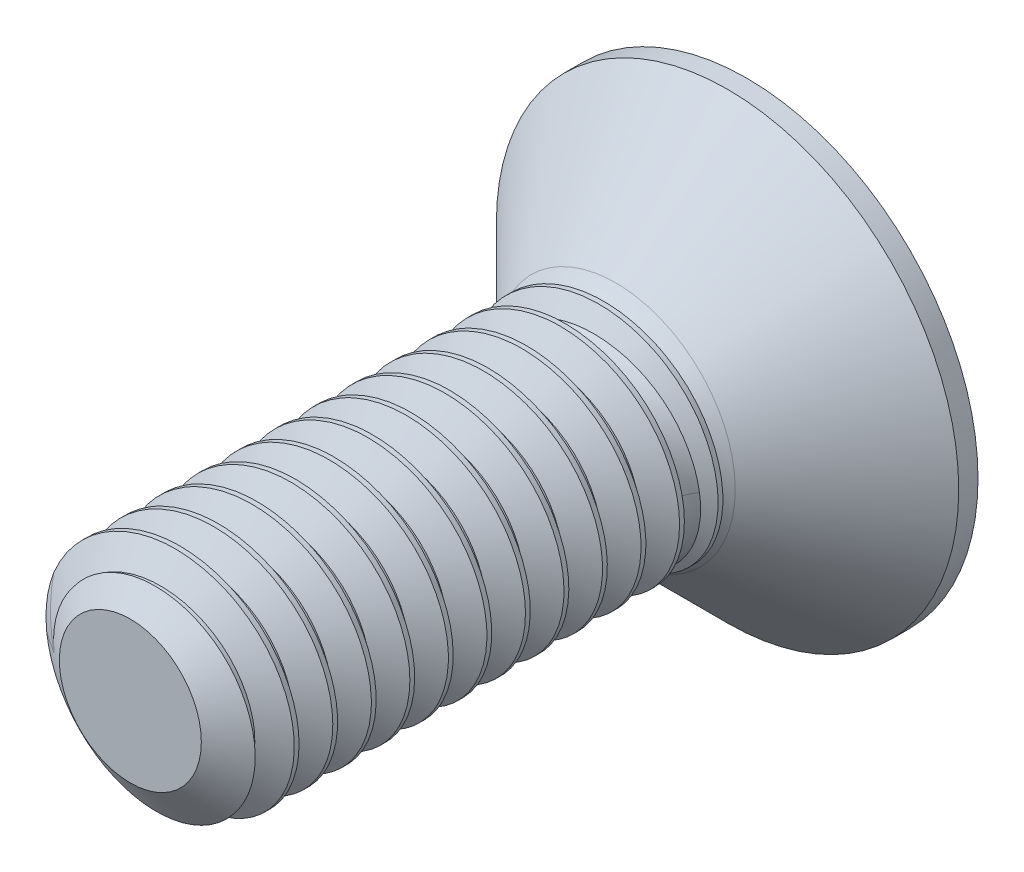
from build123d import *

# Parameters (mm, degrees)
SKETCH1_R          = 1.5
EXTRUDE1_DEPTH     = 8
CUT_SWEEP1_PITCH   = 0.5
SKETCH6_R          = 3
EXTRUDE2_DEPTH     = 1.7
CUT_EXTRUDE1_DEPTH = 1.5
SKETCH8_R          = 1.154700538
CUT_EXTRUDE2_DEPTH = 10.055385226
CUT_EXTRUDE2_TAPER = 45


with BuildPart() as part:
    # Sketch1 → Extrude1 (new body)
    with BuildSketch(Plane.XY):
        Circle(SKETCH1_R)
    extrude(amount=-EXTRUDE1_DEPTH)

    # Cut-Sweep1: the profile of Sketch3 profile screwed along a right-hand helix of 17 turns, 6 arcs to a turn; built about Z, then put on its axis
    cut_sweep1_z = Axis((0, 0, 0), (0, 0, 1))
    cut_sweep1_corners = [(1.5003, 0, -0.437673205), (1.175240474, 0, -0.25), (1.175240474, 0, -0.1875), (1.5003, 0, 0.000173205)]
    with BuildLine(mode=Mode.PRIVATE) as cut_sweep1_profile:
        Line(cut_sweep1_corners[0], cut_sweep1_corners[1])
        Line(cut_sweep1_corners[1], cut_sweep1_corners[2])
        Line(cut_sweep1_corners[2], cut_sweep1_corners[3])
        Line(cut_sweep1_corners[3], cut_sweep1_corners[0])
    cut_sweep1_cap = Face(cut_sweep1_profile.wire())
    cut_sweep1_turn_angles = [0, 30, 60, 90, 120, 150, 180, 210, 240, 270, 300, 330, 360]
    cut_sweep1_turn_weights = [1, 0.8660254037844387, 1, 0.8660254037844387, 1, 0.8660254037844387, 1, 0.8660254037844387, 1, 0.8660254037844387, 1, 0.8660254037844387, 1]
    cut_sweep1_turn_rails = [Edge.make_bspline([Vector(p[0], p[1], 0).rotate(cut_sweep1_z, cut_sweep1_turn_angles[k]) / cut_sweep1_turn_weights[k] + Vector(0, 0, p[2] + CUT_SWEEP1_PITCH * cut_sweep1_turn_angles[k] / 360) for k in range(13)], [0, 0, 0, 1, 1, 2, 2, 3, 3, 4, 4, 5, 5, 6, 6, 6], 2, cut_sweep1_turn_weights) for p in cut_sweep1_corners]
    cut_sweep1_turn_sides = [Face.make_surface_from_curves(cut_sweep1_turn_rails[p[0]], cut_sweep1_turn_rails[p[1]]) for p in [(0, 1), (1, 2), (2, 3), (3, 0)]]
    cut_sweep1 = Plane(origin=(0, 0, 0), x_dir=(0, 1, 0), z_dir=(0, 0, -1)) * Solid(Shell([*[p.moved(Location((0, 0, CUT_SWEEP1_PITCH * i))) for i in range(17) for p in cut_sweep1_turn_sides], cut_sweep1_cap, cut_sweep1_cap.rotate(cut_sweep1_z, 6120).moved(Location((0, 0, CUT_SWEEP1_PITCH * 6120 / 360)))]))
    add(cut_sweep1, mode=Mode.SUBTRACT)

    # Sketch4 → Cut-Revolve1 (revolve, cut)
    with BuildSketch(Plane(origin=(0, 0, 0), x_dir=(0, 0, -1), z_dir=(1, 0, 0)), mode=Mode.PRIVATE) as cut_revolve1_sk:
        Polygon((0.405251783, 1.5), (0, 0.921240474), (0, 1.5), align=None)
    revolve(cut_revolve1_sk.sketch.rotate(Axis((0, 0, 0), (0, 0, -1)), 90), axis=Axis((0, 0, 0), (0, 0, -1)), mode=Mode.SUBTRACT)

    # Sketch6 → Extrude2 (add)
    with BuildSketch(Plane(origin=(0, 0, -8), x_dir=(-1, 0, 0), z_dir=(0, 0, -1))):
        Circle(SKETCH6_R)
    extrude(amount=-EXTRUDE2_DEPTH)

    # Sketch10 → Cut-Revolve2 (revolve, cut)
    with BuildSketch(Plane(origin=(0, 0, 0), x_dir=(0, 0, -1), z_dir=(1, 0, 0)), mode=Mode.PRIVATE) as cut_revolve2_sk:
        Polygon((7.75, -3), (6.3, -1.55), (6.3, -3), align=None)
    revolve(cut_revolve2_sk.sketch.rotate(Axis((0, 0, 0), (0, 0, -1)), 270), axis=Axis((0, 0, 0), (0, 0, -1)), mode=Mode.SUBTRACT)

    # Sketch11 → Revolve1 (revolve)
    with BuildSketch(Plane(origin=(0, 0, 0), x_dir=(0, 0, -1), z_dir=(1, 0, 0)), mode=Mode.PRIVATE) as revolve1_sk:
        with BuildLine():
            Line((5.395250469, 1.175240474), (5.395250469, 0))
            Line((5.395250469, 0), (6.3, 0))
            Line((6.3, 0), (6.3, 1.55))
            ThreePointArc((6.3, 1.55), (5.884897387, 1.272637301), (5.395250469, 1.175240474))
        make_face()
    revolve(revolve1_sk.sketch.rotate(Axis((0, 0, 0), (0, 0, -1)), 90), axis=Axis((0, 0, 0), (0, 0, -1)))

    # Sketch7 → Cut-Extrude1 (cut)
    with BuildSketch(Plane.XY.offset(-8)):
        Polygon((0, 1.154700538), (-1, 0.577350269), (-1, -0.577350269), (0, -1.154700538), (1, -0.577350269), (1, 0.577350269), align=None)
    extrude(amount=CUT_EXTRUDE1_DEPTH, mode=Mode.SUBTRACT)

    # Sketch8 → Cut-Extrude2 (cut, through all)
    with BuildSketch(Plane.XY.offset(-8)):
        Circle(SKETCH8_R)
    extrude(amount=CUT_EXTRUDE2_DEPTH, taper=CUT_EXTRUDE2_TAPER, mode=Mode.SUBTRACT)


solid = part.part
